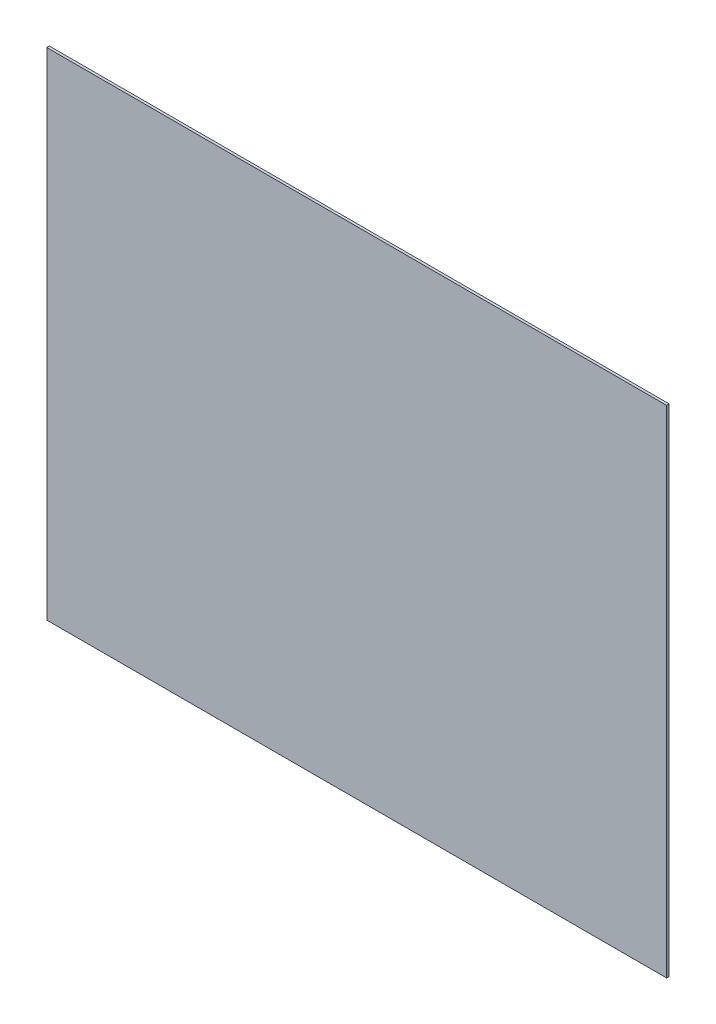
from build123d import *

# Parameters (mm, degrees)
SKETCH1_W           = 762
SKETCH1_H           = 609.6
BOSS_EXTRUDE1_DEPTH = 3.175


with BuildPart() as part:
    # Sketch1 → Boss-Extrude1 (new body)
    with BuildSketch(Plane.XY):
        with Locations((142.146174142, -33.777308707)):
            Rectangle(SKETCH1_W, SKETCH1_H)
    extrude(amount=BOSS_EXTRUDE1_DEPTH)


solid = part.part
